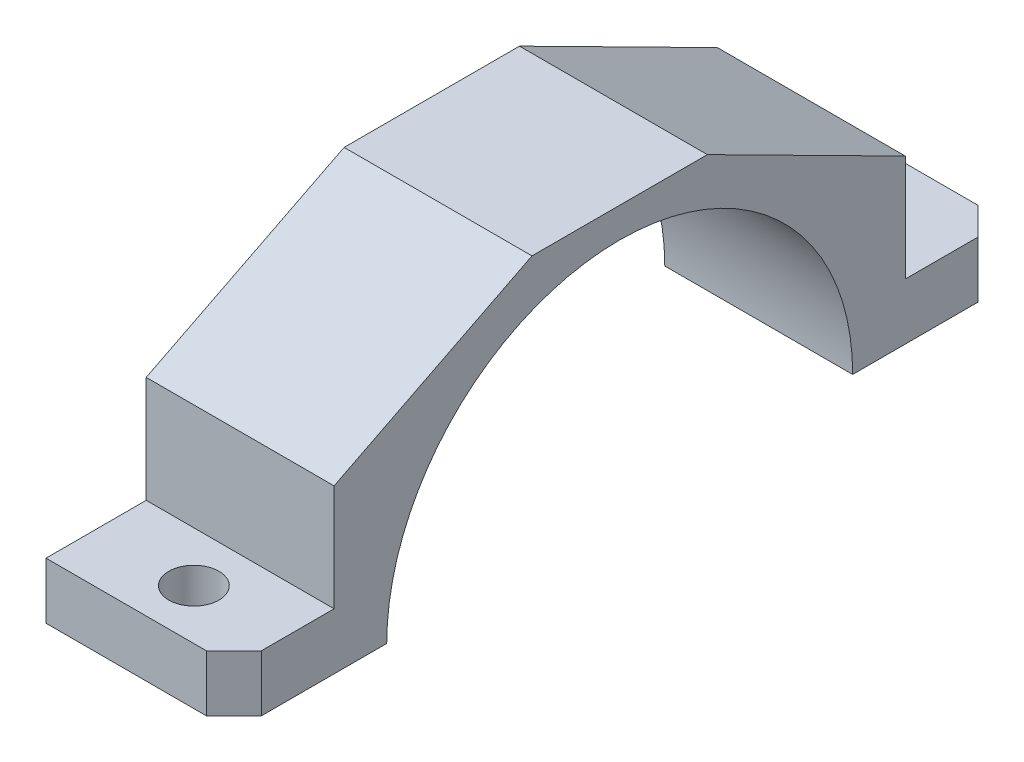
from build123d import *

# Parameters (mm, degrees)
BOSS_EXTRUDE1_DEPTH           = 7.5
CUT_EXTRUDE1_DEPTH            = 39.024860289
CSK_FOR_M4_SFHCS1_D           = 4
CSK_FOR_M4_SFHCS1_DEPTH       = 25.5
CSK_FOR_M4_SFHCS1_CSINK_D     = 7.6
CSK_FOR_M4_SFHCS1_CSINK_ANGLE = 90
CSK_FOR_M4_SFHCS1_TIP         = 1.201721238


with BuildPart() as part:
    # Sketch1 → Boss-Extrude1 (new, symmetric)
    with BuildSketch(Plane(origin=(0, 0, 0), x_dir=(0, 0, -1), z_dir=(1, 0, 0))):
        with BuildLine():
            Line((-22.8, 4.5), (-22.8, 13))
            Line((-22.8, 13), (-7, 21))
            Line((-7, 21), (7, 21))
            Line((7, 21), (22.8, 13))
            Line((22.8, 13), (22.8, 4.5))
            Line((22.8, 4.5), (30.8, 4.5))
            Line((30.8, 4.5), (30.8, 0))
            Line((30.8, 0), (18.6, 0))
            ThreePointArc((18.6, 0), (0, 18.6), (-18.6, 0))
            Line((-18.6, 0), (-30.8, 0))
            Line((-30.8, 0), (-30.8, 4.5))
            Line((-30.8, 4.5), (-22.8, 4.5))
        make_face()
    extrude(amount=BOSS_EXTRUDE1_DEPTH, both=True)

    # Sketch2 → Cut-Extrude1 (cut, through all)
    with BuildSketch(Plane.XZ):
        Polygon((5.305249497, -30.8), (7.5, -28.605249497), (7.5, -30.8), align=None)
        Polygon((5.305249497, 30.8), (7.5, 28.605249497), (7.5, 30.8), align=None)
    extrude(amount=-CUT_EXTRUDE1_DEPTH, mode=Mode.SUBTRACT)

    # CSK for M4 SFHCS1
    with Locations(Plane(origin=(1318.876465006, -21, -695.683007616), x_dir=(0, 0, 1), z_dir=(0, -1, 0))):
        with Locations((668.883007616, 1355.571215509), (668.883007616, 1318.571215509), (722.483007616, 1318.571215509), (722.483007616, 1355.571215509)):
            CounterSinkHole(CSK_FOR_M4_SFHCS1_D / 2, CSK_FOR_M4_SFHCS1_CSINK_D / 2, depth=CSK_FOR_M4_SFHCS1_DEPTH, counter_sink_angle=CSK_FOR_M4_SFHCS1_CSINK_ANGLE)
            with Locations((0, 0, -(CSK_FOR_M4_SFHCS1_DEPTH + CSK_FOR_M4_SFHCS1_TIP / 2))):  # 118° drill point
                Cone(0, CSK_FOR_M4_SFHCS1_D / 2, CSK_FOR_M4_SFHCS1_TIP, mode=Mode.SUBTRACT)


solid = part.part
